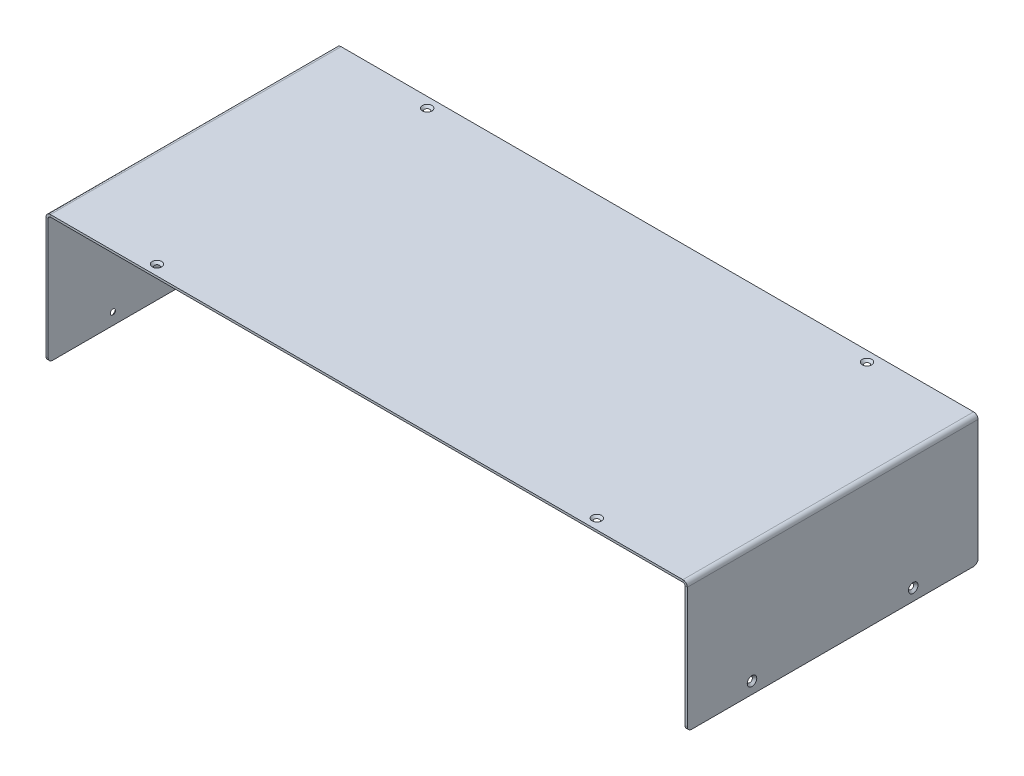
from build123d import *

# Parameters (mm, degrees)
SM_BASE_FLANGE_1_DEPTH = 198.3
FILLET_1_R             = 3
SKETCH_6_R             = 1.65
CUT_EXTRUDE_1_DEPTH    = 309.167389579
CUT_EXTRUDE_2_REACH    = 486.779
SKETCH_7_R             = 1.65
CHAMFER_2_SIZE         = 1.6


# Sheet-metal steps are written as plain solids
with BuildPart() as part:
    # Sketch 1 → Базовая кромка1 (new body)
    with BuildSketch(Plane.XY):
        with BuildLine():
            Line((-217.2, -66.1), (-217.2, 19.3))
            ThreePointArc((-217.2, 19.3), (-216.760660172, 20.360660172), (-215.7, 20.8))
            Line((-215.7, 20.8), (215.7, 20.8))
            ThreePointArc((215.7, 20.8), (216.760660172, 20.360660172), (217.2, 19.3))
            Line((217.2, 19.3), (217.2, -66.1))
            Line((217.2, -66.1), (218.7, -66.1))
            Line((218.7, -66.1), (218.7, 19.3))
            ThreePointArc((218.7, 19.3), (217.821320344, 21.421320344), (215.7, 22.3))
            Line((215.7, 22.3), (-215.7, 22.3))
            ThreePointArc((-215.7, 22.3), (-217.821320344, 21.421320344), (-218.7, 19.3))
            Line((-218.7, 19.3), (-218.7, -66.1))
            Line((-218.7, -66.1), (-217.2, -66.1))
        make_face()
    extrude(amount=SM_BASE_FLANGE_1_DEPTH)

    # Скругление1
    fillet_1_edges = [part.edges().sort_by_distance(p)[0] for p in [
        (-217.95, -66.1, 0),
        (217.95, -66.1, 0),
        (-217.95, -66.1, 198.3),
        (217.95, -66.1, 198.3),
    ]]
    fillet(fillet_1_edges, radius=FILLET_1_R)

    # Эскиз6 → Вырез-Вытянуть1 (cut, through all)
    with BuildSketch(Plane(origin=(0, 22.3, 0), x_dir=(1, 0, 0), z_dir=(0, 1, 0))):
        with Locations(Location((-150, -7, 0), (0, 0, 270))):
            Circle(SKETCH_6_R)
        with Locations(Location((150, -7, 0), (0, 0, 270))):
            Circle(SKETCH_6_R)
    cut_extrude_1 = extrude(amount=-CUT_EXTRUDE_1_DEPTH, mode=Mode.SUBTRACT)

    # Зеркальное отражение1: Вырез-Вытянуть1 across plane
    add(cut_extrude_1.mirror(Plane(origin=(0, 0, 99.15), x_dir=(1, 0, 0), z_dir=(0, 0, -1))), mode=Mode.SUBTRACT)

    # Вырез-Вытянуть2: up to this face of the body (flat: up to its plane)
    cut_extrude_2_end = Plane(part.part.faces().sort_by_distance((-218.7, -23.390410792, 99.15))[0])
    # Эскиз7 → Вырез-Вытянуть2 (cut, up to the picked face)
    with BuildSketch(Plane(origin=(218.7, 0, 0), x_dir=(0, 0, -1), z_dir=(1, 0, 0)), mode=Mode.PRIVATE) as cut_extrude_2_sk1:
        with Locations(Location((-154.15, -58.1, 0), (0, 0, 90))):
            Circle(SKETCH_7_R)
    cut_extrude_2_tool1 = split(extrude(cut_extrude_2_sk1.sketch, amount=-CUT_EXTRUDE_2_REACH, mode=Mode.PRIVATE), bisect_by=cut_extrude_2_end, keep=Keep.BOTH, mode=Mode.PRIVATE)
    # Эскиз7 → Вырез-Вытянуть2 (cut, up to the picked face)
    with BuildSketch(Plane(origin=(218.7, 0, 0), x_dir=(0, 0, -1), z_dir=(1, 0, 0)), mode=Mode.PRIVATE) as cut_extrude_2_sk2:
        with Locations(Location((-44.15, -58.1, 0), (0, 0, 90))):
            Circle(SKETCH_7_R)
    cut_extrude_2_tool2 = split(extrude(cut_extrude_2_sk2.sketch, amount=-CUT_EXTRUDE_2_REACH, mode=Mode.PRIVATE), bisect_by=cut_extrude_2_end, keep=Keep.BOTH, mode=Mode.PRIVATE)
    add(cut_extrude_2_tool1.solids().sort_by(Axis((218.7, -58.1, 154.15), (-1, 0, 0)))[0], mode=Mode.SUBTRACT)
    add(cut_extrude_2_tool2.solids().sort_by(Axis((218.7, -58.1, 44.15), (-1, 0, 0)))[0], mode=Mode.SUBTRACT)

    # Фаска2
    # the kernel refuses this chamfer: 1.6 mm, written as the material it takes off along each edge
    with BuildSketch(Plane(origin=(-218.7, -58.1, 44.15), x_dir=(0, 1, 0), z_dir=(0, 0, -1))) as chamfer_2_piece_1:
        Polygon((1.65 + CHAMFER_2_SIZE, 0), (1.65, CHAMFER_2_SIZE), (1.65, 0), align=None)
    revolve(axis=Axis((-218.7, -58.1, 44.15), (1, 0, 0)), mode=Mode.SUBTRACT)
    with BuildSketch(Plane(origin=(-218.7, -58.1, 154.15), x_dir=(0, 1, 0), z_dir=(0, 0, -1))) as chamfer_2_piece_2:
        Polygon((1.65 + CHAMFER_2_SIZE, 0), (1.65, CHAMFER_2_SIZE), (1.65, 0), align=None)
    revolve(axis=Axis((-218.7, -58.1, 154.15), (1, 0, 0)), mode=Mode.SUBTRACT)
    with BuildSketch(Plane(origin=(-150, 22.3, 191.3), x_dir=(0, 0, -1), z_dir=(-1, 0, 0))) as chamfer_2_piece_3:
        Polygon((1.65 + CHAMFER_2_SIZE, 0), (1.65, CHAMFER_2_SIZE), (1.65, 0), align=None)
    revolve(axis=Axis((-150, 22.3, 191.3), (0, -1, 0)), mode=Mode.SUBTRACT)
    with BuildSketch(Plane(origin=(-150, 22.3, 7), x_dir=(0, 0, 1), z_dir=(-1, 0, 0))) as chamfer_2_piece_4:
        Polygon((1.65 + CHAMFER_2_SIZE, 0), (1.65, -CHAMFER_2_SIZE), (1.65, 0), align=None)
    revolve(axis=Axis((-150, 22.3, 7), (0, 1, 0)), mode=Mode.SUBTRACT)
    with BuildSketch(Plane(origin=(150, 22.3, 7), x_dir=(0, 0, 1), z_dir=(-1, 0, 0))) as chamfer_2_piece_5:
        Polygon((1.65 + CHAMFER_2_SIZE, 0), (1.65, -CHAMFER_2_SIZE), (1.65, 0), align=None)
    revolve(axis=Axis((150, 22.3, 7), (0, 1, 0)), mode=Mode.SUBTRACT)
    with BuildSketch(Plane(origin=(218.7, -58.1, 44.15), x_dir=(0, 1, 0), z_dir=(0, 0, -1))) as chamfer_2_piece_6:
        Polygon((1.65 + CHAMFER_2_SIZE, 0), (1.65, -CHAMFER_2_SIZE), (1.65, 0), align=None)
    revolve(axis=Axis((218.7, -58.1, 44.15), (1, 0, 0)), mode=Mode.SUBTRACT)
    with BuildSketch(Plane(origin=(218.7, -58.1, 154.15), x_dir=(0, 1, 0), z_dir=(0, 0, -1))) as chamfer_2_piece_7:
        Polygon((1.65 + CHAMFER_2_SIZE, 0), (1.65, -CHAMFER_2_SIZE), (1.65, 0), align=None)
    revolve(axis=Axis((218.7, -58.1, 154.15), (1, 0, 0)), mode=Mode.SUBTRACT)
    with BuildSketch(Plane(origin=(150, 22.3, 191.3), x_dir=(0, 0, -1), z_dir=(-1, 0, 0))) as chamfer_2_piece_8:
        Polygon((1.65 + CHAMFER_2_SIZE, 0), (1.65, CHAMFER_2_SIZE), (1.65, 0), align=None)
    revolve(axis=Axis((150, 22.3, 191.3), (0, -1, 0)), mode=Mode.SUBTRACT)


solid = part.part
